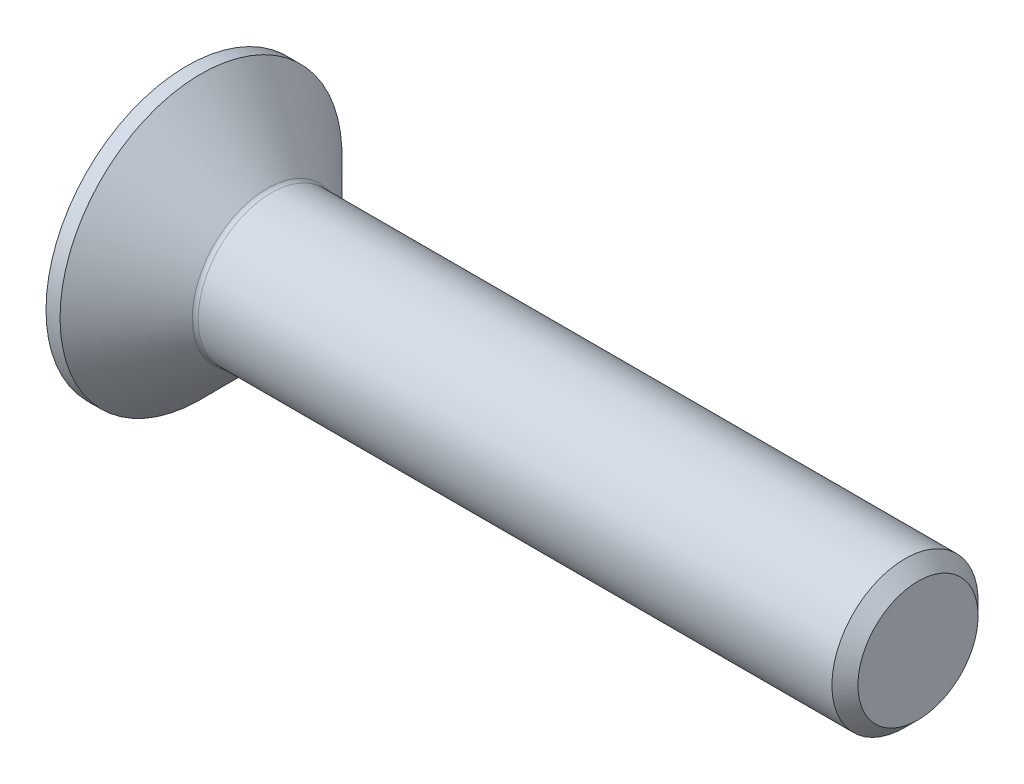
from build123d import *

# Parameters (mm, degrees)
FILLET1_R   = 0.2
HEX_START   = -2.3
HEX_2_DEPTH = 2.3


with BuildPart() as part:
    # BodySke → BaseBody (revolve)
    with BuildSketch(Plane.XY, mode=Mode.PRIVATE) as basebody_sk:
        Polygon((0, 0), (0, 4.82), (0.48, 4.82), (2.8, 2.5), (24.555, 2.5), (25, 2.055), (25, 0), align=None)
    revolve(basebody_sk.sketch.rotate(Axis((0, 0, 0), (1, 0, 0)), 90), axis=Axis((0, 0, 0), (1, 0, 0)))

    # Fillet1
    fillet1_edges = [part.edges().sort_by_distance(p)[0] for p in [
        (2.8, 0, -2.5),
    ]]
    fillet(fillet1_edges, radius=FILLET1_R)

    # Hex 2: read off the stored shape, not the designer's step
    # Hex 2 outline → Hex 2 (cut)
    with BuildSketch(Plane.ZY.offset(HEX_START)):
        Polygon((-1.51, -0.871798906), (0, -1.743597813), (1.51, -0.871798906), (1.51, 0.871798906), (0, 1.743597813), (-1.51, 0.871798906), align=None)
    extrude(amount=HEX_2_DEPTH, mode=Mode.SUBTRACT)

    # Hex 2 2 outline → Hex 2 2 (revolve, cut)
    with BuildSketch(Plane.YX):
        Polygon((1.51, 2.3), (0, 3.171798906), (0, 2.3), align=None)
    revolve(axis=Axis((0, 0, 0), (1, 0, 0)), mode=Mode.SUBTRACT)


solid = part.part
